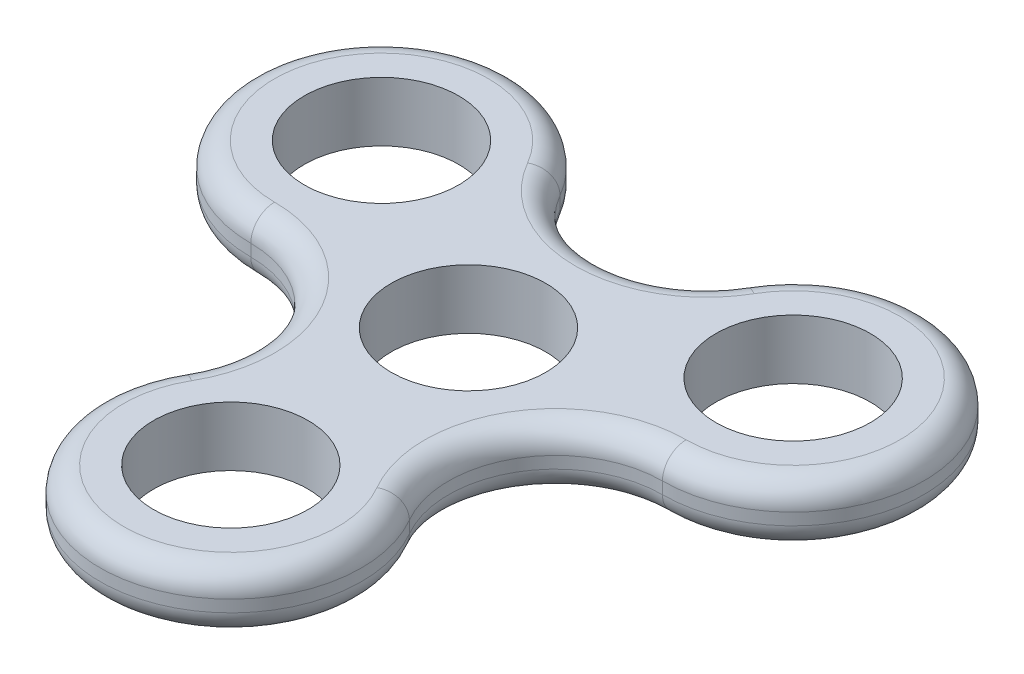
from build123d import *

# Parameters (mm, degrees)
CROQUIS1_R              = 6.5
SALIENTE_EXTRUIR1_DEPTH = 5
REDONDEO1_R             = 2


with BuildPart() as part:
    # Croquis1 → Saliente-Extruir1 (new body)
    with BuildSketch(Plane(origin=(0, 0, 0), x_dir=(1, 0, 0), z_dir=(0, 1, 0))):
        with BuildLine():
            ThreePointArc((17.320508076, -1), (26.846787517, 15.5), (7.794228634, 15.5))
            ThreePointArc((7.794228634, 15.5), (0, 11), (-7.794228634, 15.5))
            ThreePointArc((-7.794228634, 15.5), (-26.846787517, 15.5), (-17.320508076, -1))
            ThreePointArc((-17.320508076, -1), (-9.526279442, -5.5), (-9.526279442, -14.5))
            ThreePointArc((-9.526279442, -14.5), (0, -31), (9.526279442, -14.5))
            ThreePointArc((9.526279442, -14.5), (9.526279442, -5.5), (17.320508076, -1))
        make_face()
        Circle(CROQUIS1_R, mode=Mode.SUBTRACT)
        with Locations((0, -20)):
            Circle(CROQUIS1_R, mode=Mode.SUBTRACT)
        with Locations((17.320508076, 10)):
            Circle(CROQUIS1_R, mode=Mode.SUBTRACT)
        with Locations((-17.320508076, 10)):
            Circle(CROQUIS1_R, mode=Mode.SUBTRACT)
    extrude(amount=SALIENTE_EXTRUIR1_DEPTH)

    # Redondeo1
    redondeo1_edges = [part.edges().sort_by_distance(p)[0] for p in [
        (26.846787517, 5, -15.5),
        (9.526279442, 5, 5.5),
        (0, 5, 31),
        (-9.526279442, 5, 5.5),
        (-26.846787517, 5, -15.5),
        (26.846787517, 0, -15.5),
        (9.526279442, 0, 5.5),
        (0, 0, 31),
        (-9.526279442, 0, 5.5),
        (-26.846787517, 0, -15.5),
        (0, 5, -11),
        (0, 0, -11),
    ]]
    fillet(redondeo1_edges, radius=REDONDEO1_R)


solid = part.part
